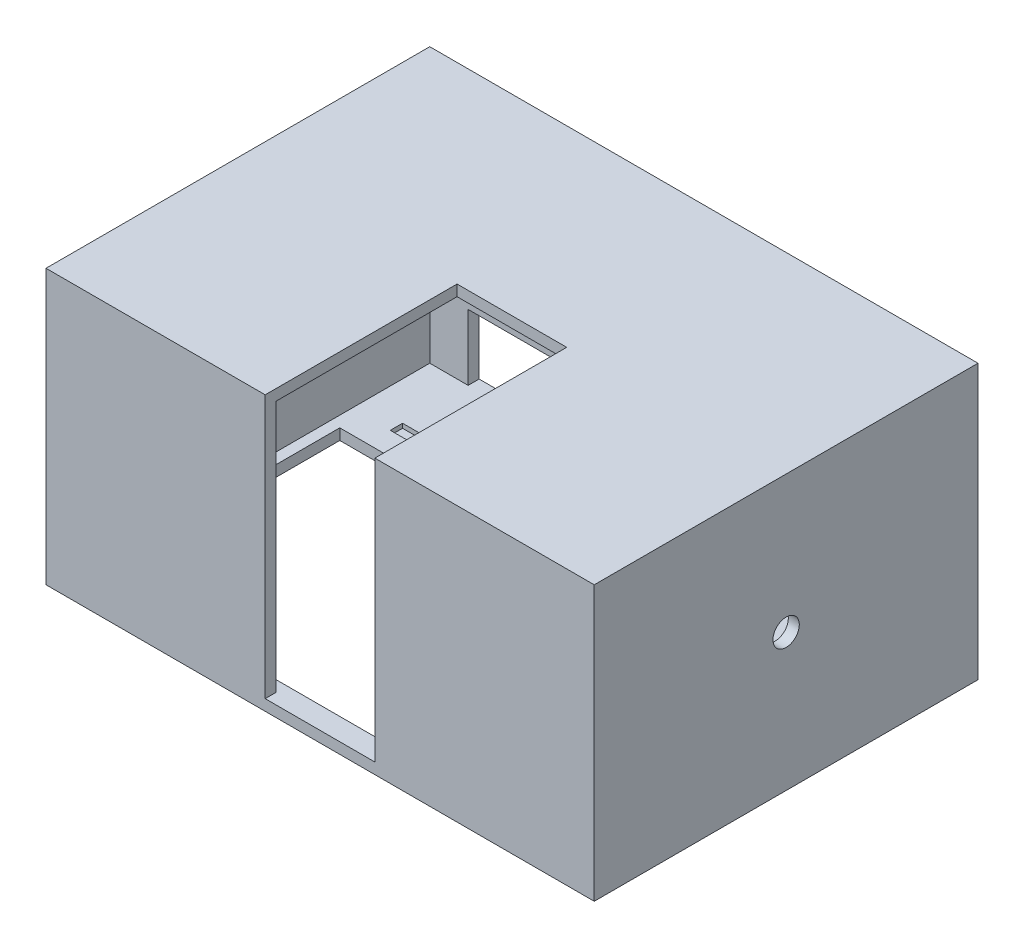
from build123d import *

# Parameters (mm, degrees)
SKETCH1_W               = 250
SKETCH1_H               = 175
BOSS_EXTRUDE1_DEPTH     = 125
SKETCH2_W               = 240
SKETCH2_H               = 165
CUT_EXTRUDE1_DEPTH      = 120
SKETCH3_W               = 40.1
SKETCH3_H               = 165
CUT_EXTRUDE2_DEPTH      = 198.246672976
SKETCH6_W               = 250
SKETCH6_H               = 175
BOSS_EXTRUDE2_DEPTH     = 5
SKETCH7_W               = 205
SKETCH7_H               = 30
PIANO_PLUG_DEPTH        = 5
ARM_HOLE_REACH          = 199.247
SKETCH8_W               = 50
SKETCH8_H               = 180
BOSS_EXTRUDE8_REACH     = 216.001
SKETCH4_R               = 6
MAIN_SHAFT_HOLE_DEPTH   = 293.884362846
CUT_EXTRUDE8_DEPTH      = 16
CUT_EXTRUDE8_DEPTH_BACK = 33
SKETCH10_R              = 20
BOTTOM_OPEN_DEPTH       = 28
BOTTOM_OPEN_DEPTH_BACK  = 21
SKETCH11_W              = 230
SKETCH11_H              = 155
SKETCH12_W              = 41.033462292
SKETCH12_H              = 5
BOSS_EXTRUDE4_DEPTH     = 233
SKETCH13_W              = 7.5
SKETCH13_H              = 80
BOSS_EXTRUDE5_DEPTH     = 49
SKETCH14_W              = 44.113211518
SKETCH14_H              = 5
BOSS_EXTRUDE6_DEPTH     = 21
FILLET2_R               = 5
SKETCH16_R              = 2.5
SKETCH16_W              = 20
SKETCH16_H              = 42
SERVO_PLUG_HOLE_DEPTH   = 106
SKETCH17_W              = 49.113211518
SKETCH17_H              = 12.164138601
BOSS_EXTRUDE7_DEPTH     = 23
SKETCH19_W              = 10.1
SKETCH19_H              = 5.6
CUT_EXTRUDE9_DEPTH      = 2
SKETCH21_W              = 10.1
SKETCH21_H              = 1.1
CUT_EXTRUDE10_DEPTH     = 10


with BuildPart() as part:
    # Sketch1 → Boss-Extrude1 (new body)
    with BuildSketch(Plane(origin=(0, 0, 0), x_dir=(1, 0, 0), z_dir=(0, 1, 0))):
        Rectangle(SKETCH1_W, SKETCH1_H)
    extrude(amount=-BOSS_EXTRUDE1_DEPTH)

    # Sketch2 → Cut-Extrude1 (cut)
    with BuildSketch(Plane.XZ.offset(125)):
        Rectangle(SKETCH2_W, SKETCH2_H)
    extrude(amount=-CUT_EXTRUDE1_DEPTH, mode=Mode.SUBTRACT)

    # Sketch3 → Cut-Extrude2 (cut, through all)
    with BuildSketch(Plane(origin=(0, 0, 0), x_dir=(1, 0, 0), z_dir=(0, 1, 0))):
        Rectangle(SKETCH3_W, SKETCH3_H)
    extrude(amount=-CUT_EXTRUDE2_DEPTH, mode=Mode.SUBTRACT)

    # Sketch6 → Boss-Extrude2 (add)
    with BuildSketch(Plane.XZ.offset(125)):
        Rectangle(SKETCH6_W, SKETCH6_H)
    extrude(amount=-BOSS_EXTRUDE2_DEPTH)

    # Sketch7 → Piano Plug (cut)
    with BuildSketch(Plane(origin=(0, 0, -87.5), x_dir=(-1, 0, 0), z_dir=(0, 0, -1))):
        with Locations((0, -105)):
            Rectangle(SKETCH7_W, SKETCH7_H)
    extrude(amount=-PIANO_PLUG_DEPTH, mode=Mode.SUBTRACT)

    # Arm Hole: up to this face of the body (flat: up to its plane)
    arm_hole_end = Plane(part.part.faces().sort_by_distance((0, -120, -2.144615385))[0])
    # Sketch8 → Arm Hole (cut, up to the picked face)
    with BuildSketch(Plane(origin=(0, 0, 0), x_dir=(1, 0, 0), z_dir=(0, 1, 0)), mode=Mode.PRIVATE) as arm_hole_sk1:
        with Locations((-0.05, -2.5)):
            Rectangle(SKETCH8_W, SKETCH8_H)
    arm_hole_tool1 = split(extrude(arm_hole_sk1.sketch, amount=-ARM_HOLE_REACH, mode=Mode.PRIVATE), bisect_by=arm_hole_end, keep=Keep.BOTH, mode=Mode.PRIVATE)
    add(arm_hole_tool1.solids().sort_by(Axis((-0.05, 0, 2.5), (0, -1, 0)))[0], mode=Mode.SUBTRACT)

    # Sketch9 → Boss-Extrude8 (add, up to next)
    with BuildSketch(Plane(origin=(-25.05, 0, 0), x_dir=(0, 0, -1), z_dir=(1, 0, 0)), mode=Mode.PRIVATE) as boss_extrude8_sk1:
        Polygon((87.5, 0), (87.5, -90), (82.5, -90), (82.5, -5), (0, -5), (0, 0), align=None)
    boss_extrude8_tool1 = extrude(boss_extrude8_sk1.sketch, amount=BOSS_EXTRUDE8_REACH, mode=Mode.PRIVATE) - part.part
    add(boss_extrude8_tool1.solids().sort_by_distance((-25.05, -45, -86.244761))[0])

    # Sketch4 → Main Shaft Hole (cut, through all)
    with BuildSketch(Plane.ZY.offset(125)):
        with Locations((0, -62.5)):
            Circle(SKETCH4_R)
    extrude(amount=-MAIN_SHAFT_HOLE_DEPTH, mode=Mode.SUBTRACT)

    # Sketch10 → Cut-Extrude8 (cut, two sides: drawn at the far end of the back side and taken through both)
    with BuildSketch(Plane.ZY.offset(125).offset(-CUT_EXTRUDE8_DEPTH_BACK)):
        with Locations((50.8, -62.5)):
            Circle(SKETCH10_R)
    extrude(amount=CUT_EXTRUDE8_DEPTH + CUT_EXTRUDE8_DEPTH_BACK, mode=Mode.SUBTRACT)

    # Sketch11 → Bottom Open (cut, two sides: drawn at the far end of the back side and taken through both)
    with BuildSketch(Plane(origin=(0, -125, 0), x_dir=(-1, 0, 0), z_dir=(0, -1, 0)).offset(-BOTTOM_OPEN_DEPTH_BACK)):
        Rectangle(SKETCH11_W, SKETCH11_H)
    extrude(amount=BOTTOM_OPEN_DEPTH + BOTTOM_OPEN_DEPTH_BACK, mode=Mode.SUBTRACT)

    # Sketch12 → Boss-Extrude4 (add)
    with BuildSketch(Plane(origin=(-115, 0, 0), x_dir=(0, 0, -1), z_dir=(1, 0, 0))):
        with Locations((56.983268854, -122.5)):
            Rectangle(SKETCH12_W, SKETCH12_H)
    extrude(amount=BOSS_EXTRUDE4_DEPTH)

    # Sketch13 → Boss-Extrude5 (add)
    with BuildSketch(Plane(origin=(0, 0, 82.5), x_dir=(-1, 0, 0), z_dir=(0, 0, -1))):
        with Locations((97.75, -80)):
            Rectangle(SKETCH13_W, SKETCH13_H)
    extrude(amount=BOSS_EXTRUDE5_DEPTH)

    # Sketch14 → Boss-Extrude6 (add)
    with BuildSketch(Plane(origin=(-115, 0, 0), x_dir=(0, 0, -1), z_dir=(1, 0, 0))):
        with Locations((-55.443394241, -122.5)):
            Rectangle(SKETCH14_W, SKETCH14_H)
    extrude(amount=BOSS_EXTRUDE6_DEPTH)

    # Fillet2
    # the kernel refuses this fillet: 5 mm, written as the material it adds along each edge
    with BuildSketch(Plane(origin=(-101.5, -120, 33.5), x_dir=(0, 1, 0), z_dir=(1, 0, 0))) as fillet2_piece_1:
        with BuildLine():
            CenterArc((1.057968965, -5), FILLET2_R, 90, 12.215768954)
            Line((0, -0.113211518), (-0.021159379, -0.015475748))
            ThreePointArc((-0.021159379, -0.015475748), (-0.1, -0.056605759), (-0.1, 0))
            Line((-0.1, 0), (0, 0.1))
            Line((0, 0.1), (1.057968965, 0.1))
            Line((1.057968965, 0.1), (1.057968965, 0))
        make_face()
    extrude(amount=7.5)

    # Sketch16 → Servo Plug Hole (cut)
    with BuildSketch(Plane(origin=(0, 0, 0), x_dir=(0, 0, -1), z_dir=(1, 0, 0))):
        with Locations((-45.543439041, -51.74216133)):
            Circle(SKETCH16_R)
        with Locations((-55.793439041, -51.74216133)):
            Circle(SKETCH16_R)
        with Locations((-50.668439041, -75.74216133)):
            Rectangle(SKETCH16_W, SKETCH16_H)
        with Locations((-45.543439041, -99.74216133)):
            Circle(SKETCH16_R)
        with Locations((-55.793439041, -99.74216133)):
            Circle(SKETCH16_R)
    extrude(amount=-SERVO_PLUG_HOLE_DEPTH, mode=Mode.SUBTRACT)

    # Sketch17 → Boss-Extrude7 (add)
    with BuildSketch(Plane.ZY.offset(101.5)):
        with Locations((57.943394241, -113.9179307)):
            Rectangle(SKETCH17_W, SKETCH17_H)
    extrude(amount=BOSS_EXTRUDE7_DEPTH)

    # Sketch19 → Cut-Extrude9 (cut)
    with BuildSketch(Plane(origin=(0, -120, 0), x_dir=(1, 0, 0), z_dir=(0, 1, 0))):
        with Locations((97.45, 49.8)):
            Rectangle(SKETCH19_W, SKETCH19_H)
        with Locations((-97.45, 49.8)):
            Rectangle(SKETCH19_W, SKETCH19_H)
        with Locations((0, 49.8)):
            Rectangle(SKETCH19_W, SKETCH19_H)
    extrude(amount=-CUT_EXTRUDE9_DEPTH, mode=Mode.SUBTRACT)

    # Sketch21 → Cut-Extrude10 (cut)
    with BuildSketch(Plane(origin=(0, 0, -87.5), x_dir=(-1, 0, 0), z_dir=(0, 0, -1))):
        with Locations((-97.45, -124)):
            Rectangle(SKETCH21_W, SKETCH21_H)
        with Locations((97.45, -124)):
            Rectangle(SKETCH21_W, SKETCH21_H)
        with Locations((0, -124)):
            Rectangle(SKETCH21_W, SKETCH21_H)
    extrude(amount=-CUT_EXTRUDE10_DEPTH, mode=Mode.SUBTRACT)


solid = part.part
